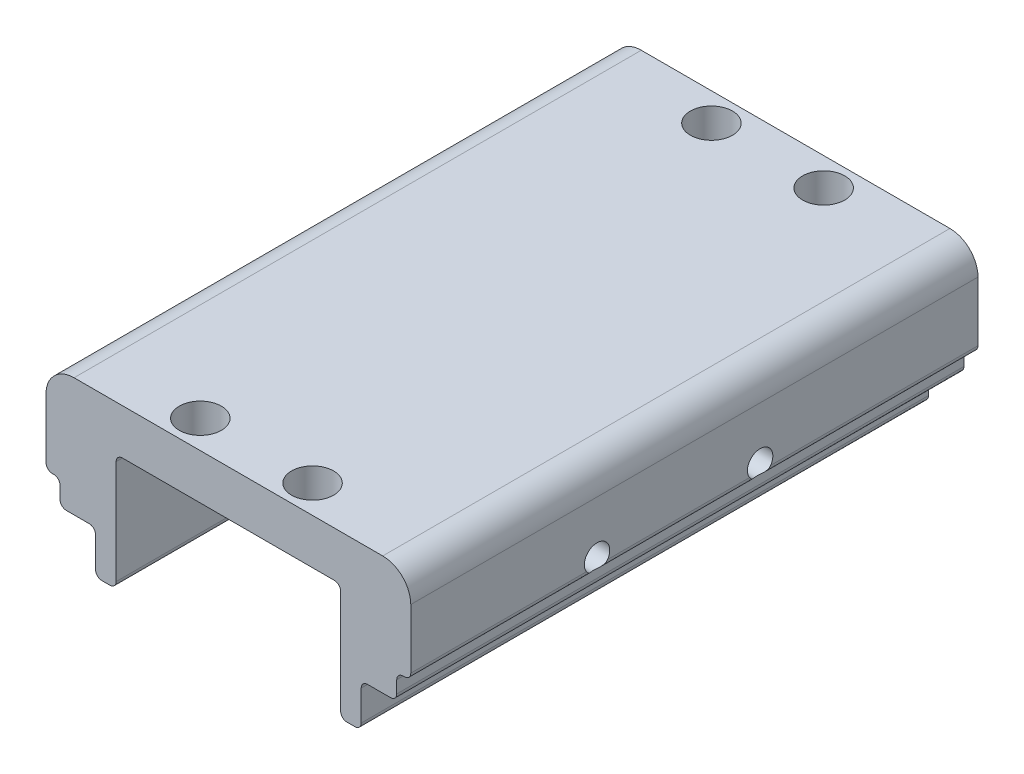
from build123d import *

# Parameters (mm, degrees)
BOSS_EXTRUDE1_DEPTH = 513.461
SKETCH2_R           = 19.05
CUT_EXTRUDE1_DEPTH  = 31.75
SKETCH3_R           = 3.2258
CUT_EXTRUDE2_DEPTH  = 31.75
SKETCH4_R           = 11.500000003
CUT_EXTRUDE3_DEPTH  = 499.872


with BuildPart() as part:
    # Sketch1 → Boss-Extrude1 (new body)
    with BuildSketch(Plane.XY):
        with BuildLine():
            ThreePointArc((-165.1, 5.715), (-163.426115254, 1.673884746), (-159.385, 0))
            Line((-159.385, 0), (-158.115, 0))
            ThreePointArc((-158.115, 0), (-154.073884746, -1.673884746), (-152.4, -5.715))
            Line((-152.4, -5.715), (-152.4, -16.91))
            ThreePointArc((-152.4, -16.91), (-150.726115254, -20.951115254), (-146.685, -22.625))
            Line((-146.685, -22.625), (-125.96, -22.625))
            ThreePointArc((-125.96, -22.625), (-121.918884746, -24.298884746), (-120.245, -28.34))
            Line((-120.245, -28.34), (-120.245, -55.82))
            ThreePointArc((-120.245, -55.82), (-118.571115254, -59.861115254), (-114.53, -61.535))
            Line((-114.53, -61.535), (-107.315, -61.535))
            ThreePointArc((-107.315, -61.535), (-103.273884746, -59.861115254), (-101.6, -55.82))
            Line((-101.6, -55.82), (-101.6, 0))
            Line((-101.6, 0), (-101.6, 38.17350945))
            ThreePointArc((-101.6, 38.17350945), (-99.926115254, 42.214624704), (-95.885, 43.88850945))
            Line((-95.885, 43.88850945), (95.885, 43.88850945))
            ThreePointArc((95.885, 43.88850945), (99.926115254, 42.214624704), (101.6, 38.17350945))
            Line((101.6, 38.17350945), (101.6, 0))
            Line((101.6, 0), (101.6, -55.82))
            ThreePointArc((101.6, -55.82), (103.273884746, -59.861115254), (107.315, -61.535))
            Line((107.315, -61.535), (114.53, -61.535))
            ThreePointArc((114.53, -61.535), (118.571115254, -59.861115254), (120.245, -55.82))
            Line((120.245, -55.82), (120.245, -28.34))
            ThreePointArc((120.245, -28.34), (121.918884746, -24.298884746), (125.96, -22.625))
            Line((125.96, -22.625), (146.685, -22.625))
            ThreePointArc((146.685, -22.625), (150.726115254, -20.951115254), (152.4, -16.91))
            Line((152.4, -16.91), (152.4, -5.715))
            ThreePointArc((152.4, -5.715), (154.073884746, -1.673884746), (158.115, 0))
            Line((158.115, 0), (159.385, 0))
            ThreePointArc((159.385, 0), (163.426115254, 1.673884746), (165.1, 5.715))
            Line((165.1, 5.715), (165.1, 59.52))
            ThreePointArc((165.1, 59.52), (157.660512242, 77.480512242), (139.7, 84.92))
            Line((139.7, 84.92), (-139.7, 84.92))
            ThreePointArc((-139.7, 84.92), (-157.660512242, 77.480512242), (-165.1, 59.52))
            Line((-165.1, 59.52), (-165.1, 5.715))
        make_face()
    extrude(amount=BOSS_EXTRUDE1_DEPTH)

    # Sketch2 → Cut-Extrude1 (cut)
    with BuildSketch(Plane(origin=(0, 84.92, 0), x_dir=(1, 0, 0), z_dir=(0, 1, 0))):
        with Locations((-50.8, -25.4)):
            Circle(SKETCH2_R)
        with Locations((50.8, -25.4)):
            Circle(SKETCH2_R)
        with Locations((50.8, -488.061)):
            Circle(SKETCH2_R)
        with Locations((-50.8, -488.061)):
            Circle(SKETCH2_R)
    extrude(amount=-CUT_EXTRUDE1_DEPTH, mode=Mode.SUBTRACT)

    # Sketch3 → Cut-Extrude2 (cut)
    with BuildSketch(Plane(origin=(0, 53.17, 0), x_dir=(1, 0, 0), z_dir=(0, 1, 0))):
        with Locations((-50.8, -25.4)):
            Circle(SKETCH3_R)
        with Locations((50.8, -25.4)):
            Circle(SKETCH3_R)
        with Locations((50.8, -488.061)):
            Circle(SKETCH3_R)
        with Locations((-50.8, -488.061)):
            Circle(SKETCH3_R)
    extrude(amount=-CUT_EXTRUDE2_DEPTH, mode=Mode.SUBTRACT)

    # Sketch4 → Cut-Extrude3 (cut)
    with BuildSketch(Plane.ZY.offset(165.1)):
        with Locations((344.866041788, 12.13850945)):
            Circle(SKETCH4_R)
        with Locations((197.228541788, 12.13850945)):
            Circle(SKETCH4_R)
    extrude(amount=-CUT_EXTRUDE3_DEPTH, mode=Mode.SUBTRACT)


solid = part.part
